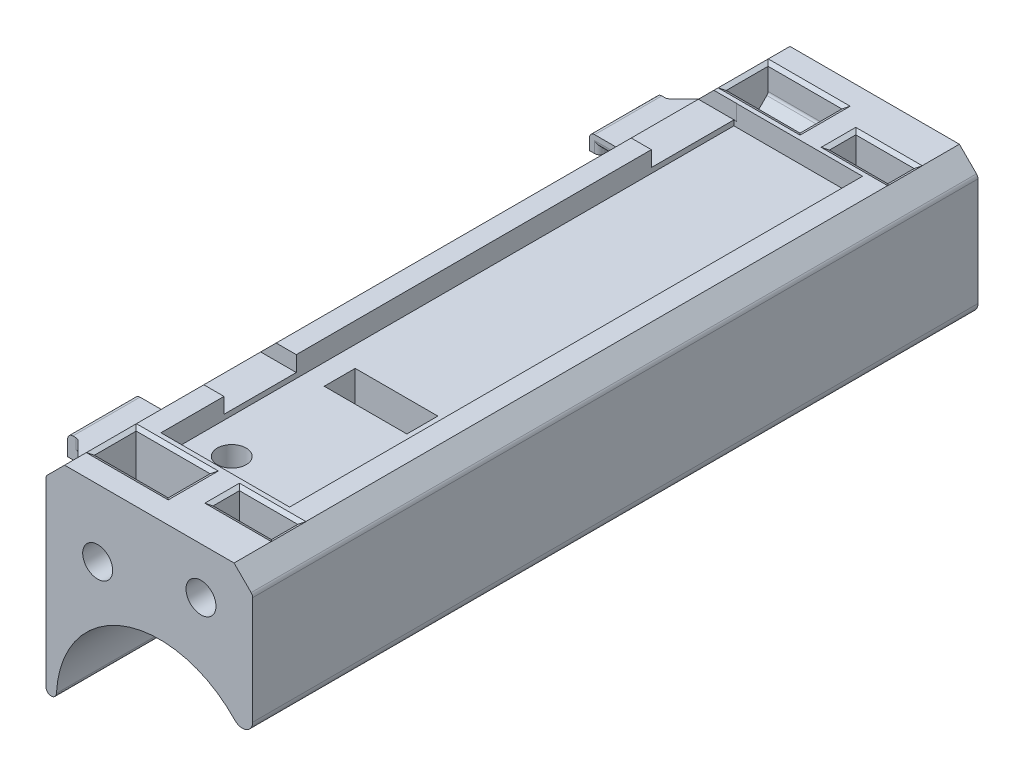
from build123d import *
from OCP.BRepFilletAPI import BRepFilletAPI_MakeChamfer

# Parameters (mm, degrees)
BOSS_EXTRUDE2_DEPTH = 35.1
CUT_EXTRUDE2_DEPTH  = 23.1
CHAMFER1_SIZE       = 1.8
FILLET1_R           = 20
FILLET3_R           = 1
FILLET2_R           = 0.5
HOLE_POSITIONS_R    = 1.45
CUT_EXTRUDE3_DEPTH  = 19
SKETCH3_W           = 5.65
SKETCH3_H           = 2.55
CUT_EXTRUDE4_DEPTH  = 7.9
SKETCH4_W           = 5.65
SKETCH4_H           = 2.55
CUT_EXTRUDE5_DEPTH  = 9.9
SKETCH5_W           = 7.15
SKETCH5_H           = 4.05
CUT_EXTRUDE6_DEPTH  = 4
CHAMFER2_SIZE       = 2.6
CHAMFER2_SIZE2      = 1.5011107
CHAMFER3_SIZE       = 1.5
CHAMFER4_SIZE       = 0.4
CHAMFER4_SIZE_2     = 0.230940108
FILLET5_R           = 0.4
BOSS_EXTRUDE3_START = 22
BOSS_EXTRUDE3_DEPTH = 10
CUT_EXTRUDE11_DEPTH = 6
CUT_EXTRUDE12_DEPTH = 1
FILLET6_R           = 0.5
FILLET8_R           = 0.5
SKETCH8_W           = 12.45
SKETCH8_H           = 55.45
CUT_EXTRUDE8_DEPTH  = 2
SKETCH10_W          = 8
SKETCH10_H          = 1.5
SKETCH10_W_2        = 7
CUT_EXTRUDE9_DEPTH  = 4
SKETCH11_R          = 1.4
SKETCH11_W          = 8
SKETCH11_H          = 3
CUT_EXTRUDE10_DEPTH = 3


with BuildPart() as part:
    # Sketch1 → Boss-Extrude2 (new body)
    with BuildSketch(Plane.XY):
        with BuildLine():
            Line((0, 0), (1, 0))
            ThreePointArc((1, 0), (8.763932023, 9.746794345), (20, 4.358898944))
            Line((20, 4.358898944), (20, 20))
            Line((20, 20), (0, 20))
            Line((0, 20), (0, 0))
        make_face()
    extrude(amount=BOSS_EXTRUDE2_DEPTH)

    # Sketch2 → Cut-Extrude2 (cut)
    with BuildSketch(Plane.ZY):
        Polygon((0, 0), (0, 6), (6, 6), (17, 0), align=None)
    extrude(amount=-CUT_EXTRUDE2_DEPTH, mode=Mode.SUBTRACT)

    # Chamfer1
    chamfer1_edges = [part.edges().sort_by_distance(p)[0] for p in [
        (0, 20, 17.55),
        (20, 20, 17.55),
    ]]
    chamfer(chamfer1_edges, length=CHAMFER1_SIZE)

    # Fillet1
    fillet1_edges = [part.edges().sort_by_distance(p)[0] for p in [
        (0.5, 0, 17),
        (1.5, 6, 6),
    ]]
    fillet(fillet1_edges, radius=FILLET1_R)

    # Fillet3
    fillet3_edges = [part.edges().sort_by_distance(p)[0] for p in [
        (20, 4.358898944, 22.054342635),
    ]]
    fillet(fillet3_edges, radius=FILLET3_R)

    # Fillet2
    fillet2_edges = [part.edges().sort_by_distance(p)[0] for p in [
        (20, 18.2, 17.55),
        (0, 18.2, 17.55),
        (0, 3, 11.5),
        (1.461007158, 3.001268991, 11.497673517),
        (0, 6, 0.450059856),
        (0, 0.620136363, 17.158131061),
        (3, 6, 0.450059856),
        (1.019341108, 0.621649581, 17.15220052),
        (0, 5.379863637, 5.841868939),
        (2.565797796, 5.372544388, 5.870484279),
        (1, 0, 28.599940144),
        (0, 0, 28.599940144),
    ]]
    fillet(fillet2_edges, radius=FILLET2_R)

    # Hole Positions → Cut-Extrude3 (cut)
    with BuildSketch(Plane.XY.offset(35.1)):
        with Locations((5, 13.5)):
            Circle(HOLE_POSITIONS_R)
        with Locations((15, 15.5)):
            Circle(HOLE_POSITIONS_R)
    extrude(amount=-CUT_EXTRUDE3_DEPTH, mode=Mode.SUBTRACT)

    # Sketch3 → Cut-Extrude4 (cut)
    with BuildSketch(Plane(origin=(0, 20, 0), x_dir=(1, 0, 0), z_dir=(0, 1, 0))):
        with Locations((5.005, -29.825)):
            Rectangle(SKETCH3_W, SKETCH3_H)
        with Locations((14.995, -29.825)):
            Rectangle(SKETCH3_W, SKETCH3_H)
    extrude(amount=-CUT_EXTRUDE4_DEPTH, mode=Mode.SUBTRACT)

    # Sketch4 → Cut-Extrude5 (cut)
    with BuildSketch(Plane(origin=(0, 20, 0), x_dir=(1, 0, 0), z_dir=(0, 1, 0))):
        with Locations((5.005, -29.825)):
            Rectangle(SKETCH4_W, SKETCH4_H)
    extrude(amount=-CUT_EXTRUDE5_DEPTH, mode=Mode.SUBTRACT)

    # Sketch5 → Cut-Extrude6 (cut)
    with BuildSketch(Plane(origin=(0, 20, 0), x_dir=(1, 0, 0), z_dir=(0, 1, 0))):
        with Locations((5.755, -30.575)):
            Rectangle(SKETCH5_W, SKETCH5_H)
    extrude(amount=-CUT_EXTRUDE6_DEPTH, mode=Mode.SUBTRACT)

    # Chamfer2: one chamfer whose edges measure the first distance from different faces: ONE call of the kernel's chamfer builder (chamfer() names one face for all edges)
    chamfer2_edges_1 = [part.edges().sort_by_distance(p)[0] for p in [
        (12.17, 12.1, 29.825),
        (17.82, 12.1, 29.825),
    ]]
    chamfer2_side_1 = [part.faces().sort_by_distance(p)[0] for p in [
        (14.995, 12.1, 29.825),
    ]]
    chamfer2_edges_2 = [part.edges().sort_by_distance(p)[0] for p in [
        (2.18, 10.1, 29.825),
        (7.83, 10.1, 29.825),
    ]]
    chamfer2_side_2 = [part.faces().sort_by_distance(p)[0] for p in [
        (5.005, 10.1, 29.825),
    ]]
    chamfer2 = BRepFilletAPI_MakeChamfer(part.part.solid().wrapped)
    for e in chamfer2_edges_1:
        chamfer2.Add(CHAMFER2_SIZE, CHAMFER2_SIZE2, e.wrapped, chamfer2_side_1[0].wrapped)  # the first distance lies on this face
    for e in chamfer2_edges_2:
        chamfer2.Add(CHAMFER2_SIZE, CHAMFER2_SIZE2, e.wrapped, chamfer2_side_2[0].wrapped)  # the first distance lies on this face
    add(Compound.cast(chamfer2.Shape()), mode=Mode.REPLACE)

    # Chamfer3
    # the kernel refuses this chamfer: 1.5 mm, written as the material it adds along each edge
    with BuildSketch(Plane(origin=(13.187524482, 16, 32.6), x_dir=(0, 0, -1), z_dir=(-1, 0, 0))) as chamfer3_piece_1_section:
        Polygon((CHAMFER3_SIZE, 0), (0, -CHAMFER3_SIZE), (0, 0), align=None)
    chamfer3_piece_1 = extrude(amount=14.865048964, mode=Mode.PRIVATE)
    chamfer3_piece_1 = split(chamfer3_piece_1, bisect_by=Plane(origin=(0, 16, 32.6), z_dir=(1, 0, 0)), keep=Keep.TOP, mode=Mode.PRIVATE)
    add(chamfer3_piece_1)
    with BuildSketch(Plane(origin=(9.33, 16, 24.692475518), x_dir=(-1, 0, 0), z_dir=(0, 0, 1))) as chamfer3_piece_2_section:
        Polygon((CHAMFER3_SIZE, 0), (0, -CHAMFER3_SIZE), (0, 0), align=None)
    chamfer3_piece_2 = extrude(amount=11.765048964, mode=Mode.PRIVATE)
    chamfer3_piece_2 = split(chamfer3_piece_2, bisect_by=Plane(origin=(9.33, 16, 35.1), z_dir=(0, 0, -1)), keep=Keep.TOP, mode=Mode.PRIVATE)
    add(chamfer3_piece_2)
    with BuildSketch(Plane(origin=(3.972475518, 16, 28.55), x_dir=(0, 0, 1), z_dir=(1, 0, 0))) as chamfer3_piece_3_section:
        Polygon((CHAMFER3_SIZE, 0), (0, -CHAMFER3_SIZE), (0, 0), align=None)
    chamfer3_piece_3 = extrude(amount=9.215048964, mode=Mode.PRIVATE)
    chamfer3_piece_3 = split(chamfer3_piece_3, bisect_by=Plane(origin=(12.17, 16, 28.55), z_dir=(-1, 0, 0)), keep=Keep.TOP, mode=Mode.PRIVATE)
    chamfer3_piece_3 = split(chamfer3_piece_3, bisect_by=Plane(origin=(5.901237759, 14.071237759, 28.55), z_dir=(0.7071067811865476, -0.7071067811865476, 0)), keep=Keep.TOP, mode=Mode.PRIVATE)
    add(chamfer3_piece_3)

    # Chamfer4
    # the kernel refuses this chamfer: 0.4, 0.230940108 mm, written as the material it takes off along each edge
    with BuildSketch(Plane(origin=(2.18, 20, 32.6), x_dir=(-1, 0, 0), z_dir=(0, 0, -1)), Plane(origin=(9.33, 20, 28.55), x_dir=(1, 0, 0), z_dir=(0, 0, 1))) as chamfer4_piece_1:
        Polygon((CHAMFER4_SIZE, 0), (0, -CHAMFER4_SIZE_2 * 0.999999998596), (0, 0), align=None)
    extrude(amount=4.05, mode=Mode.SUBTRACT)
    with BuildSketch(Plane(origin=(2.18, 20, 28.55), x_dir=(0, -1, 0), z_dir=(1, 0, 0))) as chamfer4_piece_2:
        Polygon((CHAMFER4_SIZE_2 * 0.999999998596, 0), (0, CHAMFER4_SIZE), (0, 0), align=None)
    extrude(amount=7.15, mode=Mode.SUBTRACT)
    with BuildSketch(Plane(origin=(12.17, 20, 31.1), x_dir=(0, -1, 0), z_dir=(0, 0, -1)), Plane(origin=(17.82, 20, 28.55), x_dir=(0, -1, 0), z_dir=(0, 0, 1))) as chamfer4_piece_3:
        Polygon((CHAMFER4_SIZE_2 * 0.999999998596, 0), (0, CHAMFER4_SIZE), (0, 0), align=None)
    extrude(amount=2.55, mode=Mode.SUBTRACT)
    with BuildSketch(Plane(origin=(17.82, 20, 31.1), x_dir=(0, -1, 0), z_dir=(-1, 0, 0)), Plane(origin=(12.17, 20, 28.55), x_dir=(0, -1, 0), z_dir=(1, 0, 0))) as chamfer4_piece_4:
        Polygon((CHAMFER4_SIZE_2 * 0.999999998596, 0), (0, CHAMFER4_SIZE), (0, 0), align=None)
    extrude(amount=5.65, mode=Mode.SUBTRACT)
    with BuildSketch(Plane(origin=(9.33, 20, 32.6), x_dir=(0, 0, 1), z_dir=(-1, 0, 0))) as chamfer4_piece_5:
        Polygon((CHAMFER4_SIZE, 0), (0, -CHAMFER4_SIZE_2 * 0.999999998596), (0, 0), align=None)
    extrude(amount=7.15, mode=Mode.SUBTRACT)
    with BuildSketch(Plane(origin=(2.18, 20, 33.634834302), x_dir=(-1, 0, 0), z_dir=(0, 0, -1))) as chamfer4_piece_6a_section:
        Polygon((CHAMFER4_SIZE, 0), (0, -CHAMFER4_SIZE_2 * 0.999999998596), (0, 0), align=None)
    chamfer4_piece_6a = extrude(amount=5.084834302, mode=Mode.PRIVATE)
    chamfer4_piece_6a = split(chamfer4_piece_6a, bisect_by=Plane(origin=(1.99, 20.19, 33.634834302), z_dir=(0.7071067811865477, -0.7071067811865475, 0)), keep=Keep.TOP, mode=Mode.PRIVATE)
    chamfer4_piece_6a = split(chamfer4_piece_6a, bisect_by=Plane(origin=(2.18, 20, 32.6), z_dir=(0, 0, 1)), keep=Keep.TOP, mode=Mode.PRIVATE)
    with BuildSketch(Plane(origin=(9.33, 20, 32.6), x_dir=(0, 0, 1), z_dir=(-1, 0, 0))) as chamfer4_piece_6b_section:
        Polygon((CHAMFER4_SIZE, 0), (0, -CHAMFER4_SIZE_2 * 0.999999998596), (0, 0), align=None)
    chamfer4_piece_6b = extrude(amount=8.184834302, mode=Mode.PRIVATE)
    chamfer4_piece_6b = split(chamfer4_piece_6b, bisect_by=Plane(origin=(5.565, 23.765, 32.6), z_dir=(0.7071067811865477, -0.7071067811865475, 0)), keep=Keep.TOP, mode=Mode.PRIVATE)
    chamfer4_piece_6b = split(chamfer4_piece_6b, bisect_by=Plane(origin=(2.18, 20, 32.6), z_dir=(-1, 0, 0)), keep=Keep.TOP, mode=Mode.PRIVATE)
    chamfer4_piece_6 = chamfer4_piece_6a & chamfer4_piece_6b
    add(chamfer4_piece_6, mode=Mode.SUBTRACT)
    with BuildSketch(Plane(origin=(1.145165698, 20, 28.55), x_dir=(0, -1, 0), z_dir=(1, 0, 0))) as chamfer4_piece_7a_section:
        Polygon((CHAMFER4_SIZE_2 * 0.999999998596, 0), (0, CHAMFER4_SIZE), (0, 0), align=None)
    chamfer4_piece_7a = extrude(amount=8.184834302, mode=Mode.PRIVATE)
    chamfer4_piece_7a = split(chamfer4_piece_7a, bisect_by=Plane(origin=(1.472582849, 19.672582849, 28.55), z_dir=(0.7071067811865477, -0.7071067811865475, 0)), keep=Keep.TOP, mode=Mode.PRIVATE)
    chamfer4_piece_7a = split(chamfer4_piece_7a, bisect_by=Plane(origin=(2.18, 20, 28.55), z_dir=(-1, 0, 0)), keep=Keep.TOP, mode=Mode.PRIVATE)
    with BuildSketch(Plane(origin=(2.18, 20, 32.6), x_dir=(-1, 0, 0), z_dir=(0, 0, -1))) as chamfer4_piece_7b_section:
        Polygon((CHAMFER4_SIZE, 0), (0, -CHAMFER4_SIZE_2 * 0.999999998596), (0, 0), align=None)
    chamfer4_piece_7b = extrude(amount=5.084834302, mode=Mode.PRIVATE)
    chamfer4_piece_7b = split(chamfer4_piece_7b, bisect_by=Plane(origin=(2.18, 20, 28.55), z_dir=(0, 0, -1)), keep=Keep.TOP, mode=Mode.PRIVATE)
    chamfer4_piece_7b = split(chamfer4_piece_7b, bisect_by=Plane(origin=(1.99, 20.19, 32.6), z_dir=(0.7071067811865477, -0.7071067811865475, 0)), keep=Keep.TOP, mode=Mode.PRIVATE)
    chamfer4_piece_7 = chamfer4_piece_7a & chamfer4_piece_7b
    add(chamfer4_piece_7, mode=Mode.SUBTRACT)
    with BuildSketch(Plane(origin=(2.18, 20, 28.55), x_dir=(0, -1, 0), z_dir=(1, 0, 0))) as chamfer4_piece_8a_section:
        Polygon((CHAMFER4_SIZE_2 * 0.999999998596, 0), (0, CHAMFER4_SIZE), (0, 0), align=None)
    chamfer4_piece_8a = extrude(amount=8.184834302, mode=Mode.PRIVATE)
    chamfer4_piece_8a = split(chamfer4_piece_8a, bisect_by=Plane(origin=(9.33, 20, 28.55), z_dir=(1, 0, 0)), keep=Keep.TOP, mode=Mode.PRIVATE)
    with BuildSketch(Plane(origin=(9.33, 20, 27.515165698), x_dir=(1, 0, 0), z_dir=(0, 0, 1))) as chamfer4_piece_8b_section:
        Polygon((CHAMFER4_SIZE, 0), (0, -CHAMFER4_SIZE_2 * 0.999999998596), (0, 0), align=None)
    chamfer4_piece_8b = extrude(amount=5.084834302, mode=Mode.PRIVATE)
    chamfer4_piece_8b = split(chamfer4_piece_8b, bisect_by=Plane(origin=(9.33, 20, 28.55), z_dir=(0, 0, -1)), keep=Keep.TOP, mode=Mode.PRIVATE)
    chamfer4_piece_8 = chamfer4_piece_8a & chamfer4_piece_8b
    add(chamfer4_piece_8, mode=Mode.SUBTRACT)
    with BuildSketch(Plane(origin=(17.82, 20, 31.1), x_dir=(0, -1, 0), z_dir=(-1, 0, 0))) as chamfer4_piece_9a_section:
        Polygon((CHAMFER4_SIZE_2 * 0.999999998596, 0), (0, CHAMFER4_SIZE), (0, 0), align=None)
    chamfer4_piece_9a = extrude(amount=6.684834302, mode=Mode.PRIVATE)
    chamfer4_piece_9a = split(chamfer4_piece_9a, bisect_by=Plane(origin=(12.17, 20, 31.1), z_dir=(-1, 0, 0)), keep=Keep.TOP, mode=Mode.PRIVATE)
    with BuildSketch(Plane(origin=(12.17, 20, 32.134834302), x_dir=(0, -1, 0), z_dir=(0, 0, -1))) as chamfer4_piece_9b_section:
        Polygon((CHAMFER4_SIZE_2 * 0.999999998596, 0), (0, CHAMFER4_SIZE), (0, 0), align=None)
    chamfer4_piece_9b = extrude(amount=3.584834302, mode=Mode.PRIVATE)
    chamfer4_piece_9b = split(chamfer4_piece_9b, bisect_by=Plane(origin=(12.17, 20, 31.1), z_dir=(0, 0, 1)), keep=Keep.TOP, mode=Mode.PRIVATE)
    chamfer4_piece_9 = chamfer4_piece_9a & chamfer4_piece_9b
    add(chamfer4_piece_9, mode=Mode.SUBTRACT)
    with BuildSketch(Plane(origin=(11.135165698, 20, 28.55), x_dir=(0, -1, 0), z_dir=(1, 0, 0))) as chamfer4_piece_10a_section:
        Polygon((CHAMFER4_SIZE_2 * 0.999999998596, 0), (0, CHAMFER4_SIZE), (0, 0), align=None)
    chamfer4_piece_10a = extrude(amount=6.684834302, mode=Mode.PRIVATE)
    chamfer4_piece_10a = split(chamfer4_piece_10a, bisect_by=Plane(origin=(12.17, 20, 28.55), z_dir=(-1, 0, 0)), keep=Keep.TOP, mode=Mode.PRIVATE)
    with BuildSketch(Plane(origin=(12.17, 20, 31.1), x_dir=(0, -1, 0), z_dir=(0, 0, -1))) as chamfer4_piece_10b_section:
        Polygon((CHAMFER4_SIZE_2 * 0.999999998596, 0), (0, CHAMFER4_SIZE), (0, 0), align=None)
    chamfer4_piece_10b = extrude(amount=3.584834302, mode=Mode.PRIVATE)
    chamfer4_piece_10b = split(chamfer4_piece_10b, bisect_by=Plane(origin=(12.17, 20, 28.55), z_dir=(0, 0, -1)), keep=Keep.TOP, mode=Mode.PRIVATE)
    chamfer4_piece_10 = chamfer4_piece_10a & chamfer4_piece_10b
    add(chamfer4_piece_10, mode=Mode.SUBTRACT)
    with BuildSketch(Plane(origin=(18.854834302, 20, 31.1), x_dir=(0, -1, 0), z_dir=(-1, 0, 0))) as chamfer4_piece_11a_section:
        Polygon((CHAMFER4_SIZE_2 * 0.999999998596, 0), (0, CHAMFER4_SIZE), (0, 0), align=None)
    chamfer4_piece_11a = extrude(amount=6.684834302, mode=Mode.PRIVATE)
    chamfer4_piece_11a = split(chamfer4_piece_11a, bisect_by=Plane(origin=(17.82, 20, 31.1), z_dir=(1, 0, 0)), keep=Keep.TOP, mode=Mode.PRIVATE)
    chamfer4_piece_11a = split(chamfer4_piece_11a, bisect_by=Plane(origin=(18.527417151, 19.672582849, 31.1), z_dir=(-0.7071067811865476, -0.7071067811865476, 0)), keep=Keep.TOP, mode=Mode.PRIVATE)
    with BuildSketch(Plane(origin=(17.82, 20, 28.55), x_dir=(0, -1, 0), z_dir=(0, 0, 1))) as chamfer4_piece_11b_section:
        Polygon((CHAMFER4_SIZE_2 * 0.999999998596, 0), (0, CHAMFER4_SIZE), (0, 0), align=None)
    chamfer4_piece_11b = extrude(amount=3.584834302, mode=Mode.PRIVATE)
    chamfer4_piece_11b = split(chamfer4_piece_11b, bisect_by=Plane(origin=(17.82, 20, 31.1), z_dir=(0, 0, 1)), keep=Keep.TOP, mode=Mode.PRIVATE)
    chamfer4_piece_11b = split(chamfer4_piece_11b, bisect_by=Plane(origin=(18.01, 20.19, 28.55), z_dir=(-0.7071067811865476, -0.7071067811865476, 0)), keep=Keep.TOP, mode=Mode.PRIVATE)
    chamfer4_piece_11 = chamfer4_piece_11a & chamfer4_piece_11b
    add(chamfer4_piece_11, mode=Mode.SUBTRACT)
    with BuildSketch(Plane(origin=(12.17, 20, 28.55), x_dir=(0, -1, 0), z_dir=(1, 0, 0))) as chamfer4_piece_12a_section:
        Polygon((CHAMFER4_SIZE_2 * 0.999999998596, 0), (0, CHAMFER4_SIZE), (0, 0), align=None)
    chamfer4_piece_12a = extrude(amount=6.684834302, mode=Mode.PRIVATE)
    chamfer4_piece_12a = split(chamfer4_piece_12a, bisect_by=Plane(origin=(17.82, 20, 28.55), z_dir=(1, 0, 0)), keep=Keep.TOP, mode=Mode.PRIVATE)
    chamfer4_piece_12a = split(chamfer4_piece_12a, bisect_by=Plane(origin=(15.185, 23.015, 28.55), z_dir=(-0.7071067811865476, -0.7071067811865476, 0)), keep=Keep.TOP, mode=Mode.PRIVATE)
    with BuildSketch(Plane(origin=(17.82, 20, 27.515165698), x_dir=(0, -1, 0), z_dir=(0, 0, 1))) as chamfer4_piece_12b_section:
        Polygon((CHAMFER4_SIZE_2 * 0.999999998596, 0), (0, CHAMFER4_SIZE), (0, 0), align=None)
    chamfer4_piece_12b = extrude(amount=3.584834302, mode=Mode.PRIVATE)
    chamfer4_piece_12b = split(chamfer4_piece_12b, bisect_by=Plane(origin=(17.82, 20, 28.55), z_dir=(0, 0, -1)), keep=Keep.TOP, mode=Mode.PRIVATE)
    chamfer4_piece_12b = split(chamfer4_piece_12b, bisect_by=Plane(origin=(18.01, 20.19, 27.515165698), z_dir=(-0.7071067811865476, -0.7071067811865476, 0)), keep=Keep.TOP, mode=Mode.PRIVATE)
    chamfer4_piece_12 = chamfer4_piece_12a & chamfer4_piece_12b
    add(chamfer4_piece_12, mode=Mode.SUBTRACT)
    with BuildSketch(Plane(origin=(10.364834302, 20, 32.6), x_dir=(0, 0, 1), z_dir=(-1, 0, 0))) as chamfer4_piece_13a_section:
        Polygon((CHAMFER4_SIZE, 0), (0, -CHAMFER4_SIZE_2 * 0.999999998596), (0, 0), align=None)
    chamfer4_piece_13a = extrude(amount=8.184834302, mode=Mode.PRIVATE)
    chamfer4_piece_13a = split(chamfer4_piece_13a, bisect_by=Plane(origin=(9.33, 20, 32.6), z_dir=(1, 0, 0)), keep=Keep.TOP, mode=Mode.PRIVATE)
    with BuildSketch(Plane(origin=(9.33, 20, 28.55), x_dir=(1, 0, 0), z_dir=(0, 0, 1))) as chamfer4_piece_13b_section:
        Polygon((CHAMFER4_SIZE, 0), (0, -CHAMFER4_SIZE_2 * 0.999999998596), (0, 0), align=None)
    chamfer4_piece_13b = extrude(amount=5.084834302, mode=Mode.PRIVATE)
    chamfer4_piece_13b = split(chamfer4_piece_13b, bisect_by=Plane(origin=(9.33, 20, 32.6), z_dir=(0, 0, 1)), keep=Keep.TOP, mode=Mode.PRIVATE)
    chamfer4_piece_13 = chamfer4_piece_13a & chamfer4_piece_13b
    add(chamfer4_piece_13, mode=Mode.SUBTRACT)

    # Fillet5
    fillet5_edges = [part.edges().sort_by_distance(p)[0] for p in [
        (7.83, 16, 29.825),
        (5.005, 16, 31.1),
        (5.23, 10.1, 29.825),
        (4.78, 10.1, 29.825),
        (15.22, 12.1, 29.825),
        (14.77, 12.1, 29.825),
        (5.755, 17.5, 32.6),
        (9.33, 17.5, 30.575),
    ]]
    fillet(fillet5_edges, radius=FILLET5_R)

    # Sketch13 → Boss-Extrude3 (add)
    with BuildSketch(Plane.XY.offset(BOSS_EXTRUDE3_START)):
        Polygon((0, 15.25), (-3.5, 15.25), (-3.5, 11.75), (0, 11.75), (0, 10.75), (-3.5, 10.75), (-4.5, 10.75), (-4.5, 16.25), (-3.5, 16.25), (0, 16.25), align=None)
    extrude(amount=BOSS_EXTRUDE3_DEPTH)

    # Sketch14 → Cut-Extrude11 (cut)
    with BuildSketch(Plane.XZ.offset(-10.75)):
        Polygon((0, 32), (-3.5, 28.5), (-4.5, 28.5), (-4.5, 32), align=None)
    extrude(amount=-CUT_EXTRUDE11_DEPTH, mode=Mode.SUBTRACT)

    # Sketch15 → Cut-Extrude12 (cut)
    with BuildSketch(Plane.ZY.offset(4.5)):
        Polygon((28.5, 13.5), (28.5, 14.25), (25.5, 14.25), (24.372368855, 14.660424172), (22, 14.660424172), (22, 13.160424172), (24.372368855, 13.160424172), (25.5, 12.75), (28.5, 12.75), align=None)
    extrude(amount=-CUT_EXTRUDE12_DEPTH, mode=Mode.SUBTRACT)

    # Fillet6
    # the kernel refuses this fillet: 0.5 mm, written as the material it adds along each edge
    with BuildSketch(Plane(origin=(0, 16.25, 22), x_dir=(0, 1, 0), z_dir=(0, 0, 1))) as fillet6_piece_1_section:
        with BuildLine():
            CenterArc((FILLET6_R, FILLET6_R), FILLET6_R, 180, 90)
            Line((0, FILLET6_R), (0, 0))
            Line((0, 0), (FILLET6_R, 0))
        make_face()
    fillet6_piece_1 = extrude(amount=11.25, mode=Mode.PRIVATE)
    fillet6_piece_1 = split(fillet6_piece_1, bisect_by=Plane(origin=(-5, 16.25, 27), z_dir=(0.7071067811865439, 0, -0.7071067811865511)), keep=Keep.TOP, mode=Mode.PRIVATE)
    add(fillet6_piece_1)
    with BuildSketch(Plane(origin=(0, 10.75, 22), x_dir=(0, -1, 0), z_dir=(0, 0, 1))) as fillet6_piece_2_section:
        with BuildLine():
            CenterArc((FILLET6_R, -FILLET6_R), FILLET6_R, 90, 90)
            Line((0, -FILLET6_R), (0, 0))
            Line((0, 0), (FILLET6_R, 0))
        make_face()
    fillet6_piece_2 = extrude(amount=11.25, mode=Mode.PRIVATE)
    fillet6_piece_2 = split(fillet6_piece_2, bisect_by=Plane(origin=(-5, 10.75, 27), z_dir=(0.7071067811865439, 0, -0.7071067811865511)), keep=Keep.TOP, mode=Mode.PRIVATE)
    add(fillet6_piece_2)

    # Fillet8
    fillet8_edges = [part.edges().sort_by_distance(p)[0] for p in [
        (-1.75, 11.75, 22),
        (-3.5, 12.455212086, 22),
        (-1.75, 15.25, 22),
        (-4.5, 10.75, 25.25),
        (-4.5, 16.25, 25.25),
        (-3.5, 15.75, 28.5),
        (-3.5, 11.25, 28.5),
        (-3.5, 14.955212086, 22),
    ]]
    fillet(fillet8_edges, radius=FILLET8_R)

    # Mirror1: part across plane


with BuildPart() as part_1:
    add(part.part)
    add(part.part.mirror(Plane(origin=(11, 0, 0), x_dir=(1, 0, 0), z_dir=(0, 0, 1))))

    # Sketch8 → Cut-Extrude8 (cut)
    with BuildSketch(Plane(origin=(0, 20, 0), x_dir=(1, 0, 0), z_dir=(0, 1, 0))):
        with Locations((9.975, 0)):
            Rectangle(SKETCH8_W, SKETCH8_H)
    extrude(amount=-CUT_EXTRUDE8_DEPTH, mode=Mode.SUBTRACT)

    # Sketch10 → Cut-Extrude9 (cut)
    with BuildSketch(Plane.ZY):
        with Locations((-23.737742543, 19.25)):
            Rectangle(SKETCH10_W, SKETCH10_H)
        with Locations((18.125, 19.25)):
            Rectangle(SKETCH10_W_2, SKETCH10_H)
    extrude(amount=-CUT_EXTRUDE9_DEPTH, mode=Mode.SUBTRACT)

    # Sketch11 → Cut-Extrude10 (cut)
    with BuildSketch(Plane(origin=(0, 18, 0), x_dir=(1, 0, 0), z_dir=(0, 1, 0))):
        with Locations(Location((7.15, -24.275, 0), (0, 0, 270))):
            Circle(SKETCH11_R)
        with Locations((9.75, -12.425)):
            Rectangle(SKETCH11_W, SKETCH11_H)
    extrude(amount=-CUT_EXTRUDE10_DEPTH, mode=Mode.SUBTRACT)


solid = part_1.part
